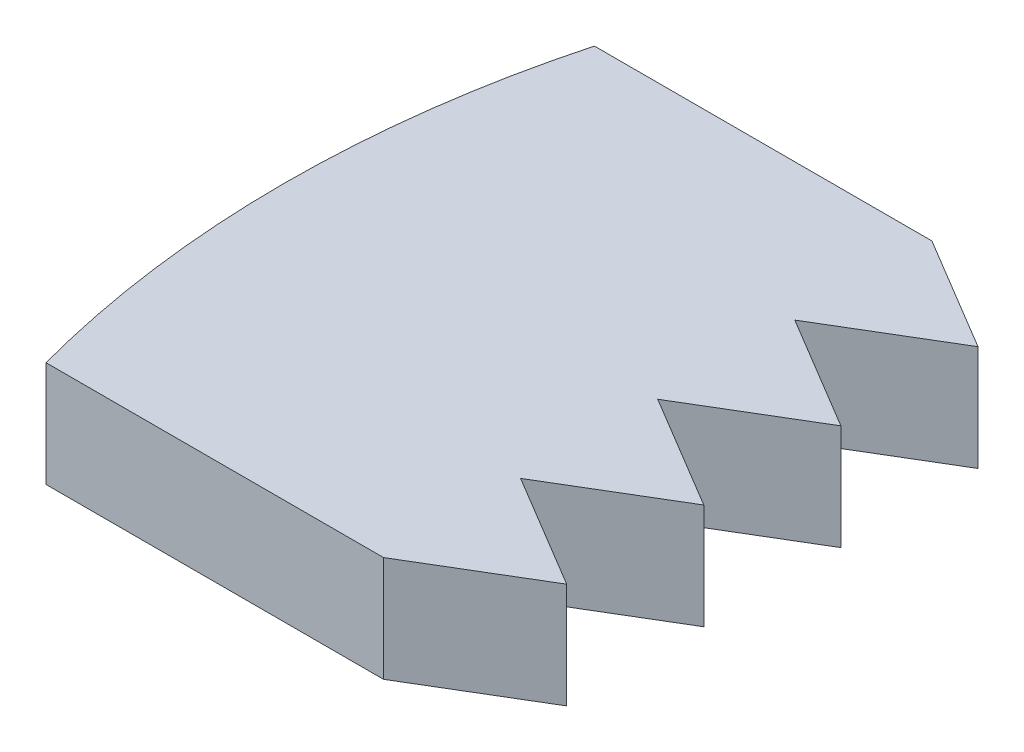
from build123d import *

# Parameters (mm, degrees)
BOSS_EXTRUDE1_DEPTH = 3.81


with BuildPart() as part:
    # Sketch1 → Boss-Extrude1 (new body)
    with BuildSketch(Plane(origin=(0, 0, 0), x_dir=(1, 0, 0), z_dir=(0, 1, 0))):
        with BuildLine():
            Line((-22.989077017, 27.306180372), (-18.846949092, 24.829680372))
            Line((-18.846949092, 24.829680372), (-22.989077017, 22.353180372))
            Line((-22.989077017, 22.353180372), (-18.846949092, 19.876680372))
            Line((-18.846949092, 19.876680372), (-22.989077017, 17.400180372))
            Line((-22.989077017, 17.400180372), (-18.846949092, 14.923680372))
            Line((-18.846949092, 14.923680372), (-22.989077017, 12.447180372))
            Line((-22.989077017, 12.447180372), (-18.846949092, 9.970680372))
            Line((-18.846949092, 9.970680372), (-22.989077017, 7.494180372))
            Line((-22.989077017, 7.494180372), (-35.181077017, 7.494180372))
            ThreePointArc((-35.181077017, 7.494180372), (-36.491388734, 17.400180372), (-35.181077017, 27.306180372))
            Line((-35.181077017, 27.306180372), (-22.989077017, 27.306180372))
        make_face()
    extrude(amount=BOSS_EXTRUDE1_DEPTH)


solid = part.part
